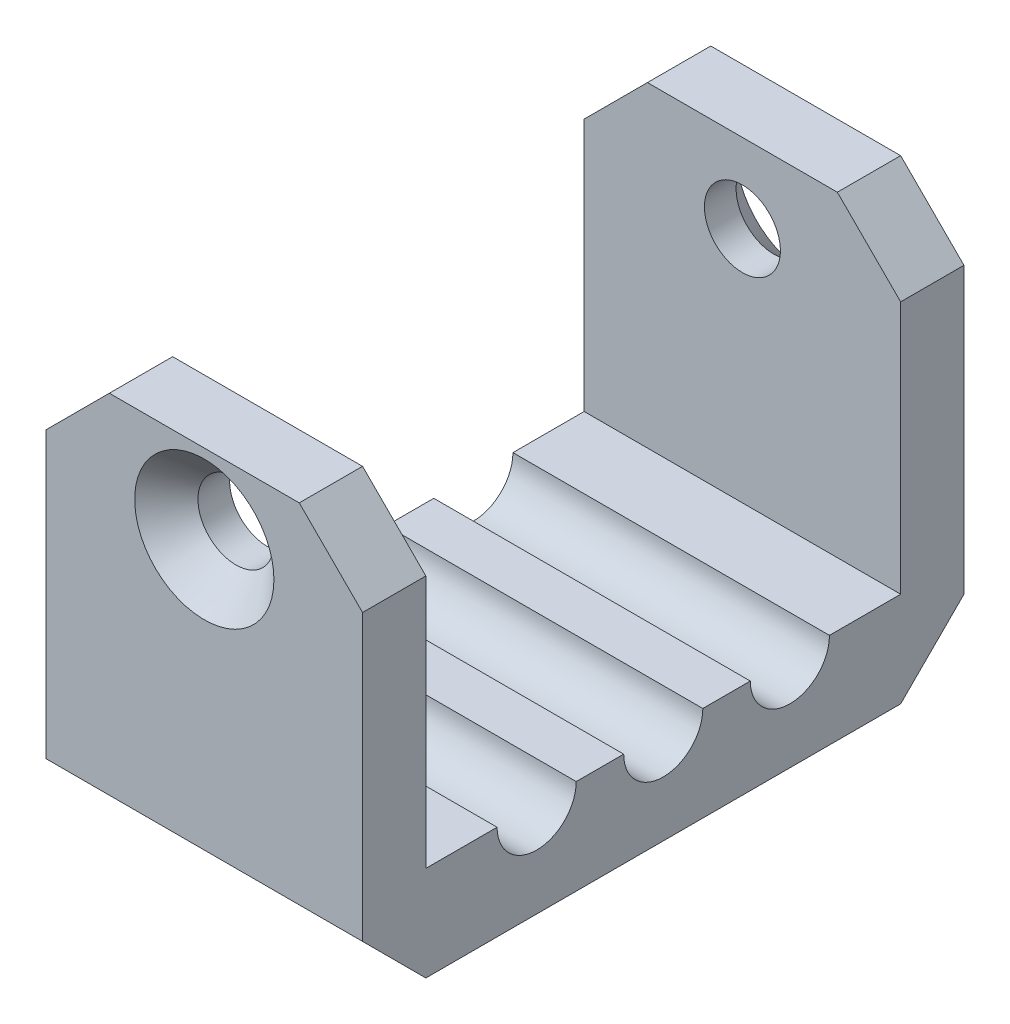
from build123d import *

# Parameters (mm, degrees)
SKETCH1_W           = 10
SKETCH1_H           = 15
BOSS_EXTRUDE1_DEPTH = 3
SKETCH2_R           = 1.25
CUT_EXTRUDE1_DEPTH  = 13.854960132
SKETCH3_W           = 10
SKETCH3_H           = 13
BOSS_EXTRUDE2_DEPTH = 2
CHAMFER1_SIZE       = 2
CHAMFER2_SIZE       = 2


with BuildPart() as part:
    # Sketch1 → Boss-Extrude1 (new body)
    with BuildSketch(Plane(origin=(0, 0, 0), x_dir=(1, 0, 0), z_dir=(0, 1, 0))):
        Rectangle(SKETCH1_W, SKETCH1_H)
    extrude(amount=BOSS_EXTRUDE1_DEPTH)

    # Sketch2 → Cut-Extrude1 (cut, through all)
    with BuildSketch(Plane(origin=(5, 0, 0), x_dir=(0, 0, -1), z_dir=(1, 0, 0))):
        with Locations((0, 3)):
            Circle(SKETCH2_R)
        with Locations((-4, 3)):
            Circle(SKETCH2_R)
        with Locations((4, 3)):
            Circle(SKETCH2_R)
    extrude(amount=-CUT_EXTRUDE1_DEPTH, mode=Mode.SUBTRACT)

    # Sketch3 → Boss-Extrude2 (add)
    with BuildSketch(Plane.XY.offset(7.5)):
        with Locations((0, 6.5)):
            Rectangle(SKETCH3_W, SKETCH3_H)
    boss_extrude2 = extrude(amount=BOSS_EXTRUDE2_DEPTH)

    # Mirror1: Boss-Extrude2 across plane
    add(boss_extrude2.mirror(Plane.XY))

    # Sketch5 → CSK for M2 Flat Head Machine Screw1 (revolve, cut)
    with BuildSketch(Plane(origin=(0, 10.5, 9.5), x_dir=(0, -1, 0), z_dir=(1, 0, 0))):
        Polygon((0, 0), (0, 5.721032743), (1.2, 5), (1.2, 1), (2.2, 0), align=None)
    csk_for_m2_flat_head_machine_screw1 = revolve(axis=Axis((0, 10.5, 15.85), (0, 0, -1)), mode=Mode.SUBTRACT)

    # Mirror2: CSK for M2 Flat Head Machine Screw1 across plane
    add(csk_for_m2_flat_head_machine_screw1.mirror(Plane.XY), mode=Mode.SUBTRACT)

    # Chamfer1
    chamfer1_edges = [part.edges().sort_by_distance(p)[0] for p in [
        (0, 0, -9.5),
        (0, 0, 9.5),
    ]]
    chamfer(chamfer1_edges, length=CHAMFER1_SIZE)

    # Chamfer2
    chamfer2_edges = [part.edges().sort_by_distance(p)[0] for p in [
        (5, 13, -8.5),
        (-5, 13, -8.5),
        (5, 13, 8.5),
        (-5, 13, 8.5),
    ]]
    chamfer(chamfer2_edges, length=CHAMFER2_SIZE)


solid = part.part
